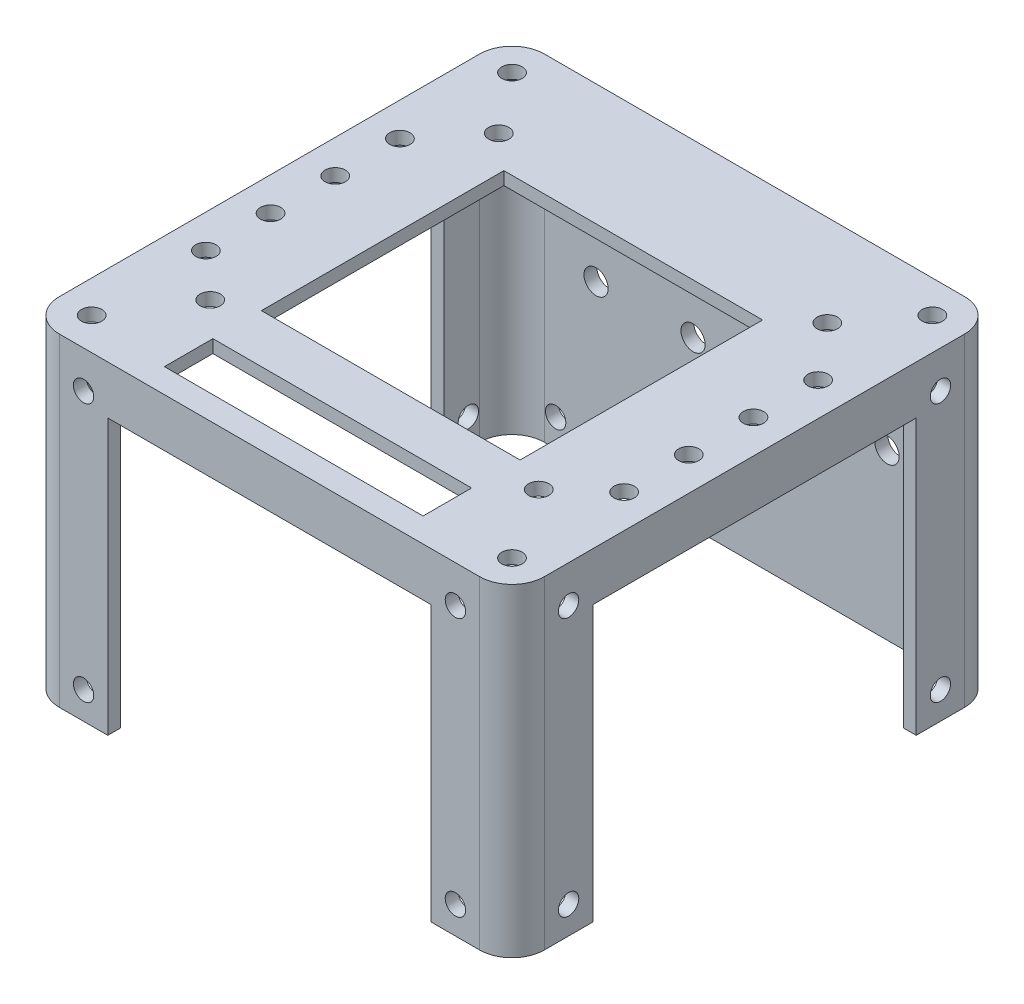
from build123d import *

# Parameters (mm, degrees)
SKETCH9_R                 = 3.15
BOSS_EXTRUDE10_DEPTH      = 10
BOSS_EXTRUDE10_2_DEPTH    = 10
BOSS_EXTRUDE10_3_DEPTH    = 10
BOSS_EXTRUDE10_4_DEPTH    = 10
BOSS_EXTRUDE10_5_DEPTH    = 10
BOSS_EXTRUDE10_6_DEPTH    = 10
BOSS_EXTRUDE10_7_DEPTH    = 10
BOSS_EXTRUDE10_8_DEPTH    = 10
SKETCH10_W                = 80
SKETCH10_H                = 75
BOSS_EXTRUDE12_DEPTH      = 10
SKETCH15_R                = 3.15
BOSS_EXTRUDE17_DEPTH      = 10
BOSS_EXTRUDE17_2_DEPTH    = 10
BOSS_EXTRUDE17_3_DEPTH    = 10
BOSS_EXTRUDE17_4_DEPTH    = 10
SKETCH22_W                = 150
SKETCH22_H                = 150
BOSS_EXTRUDE19_DEPTH      = 4
SKETCH29_W                = 150
SKETCH29_H                = 150
SKETCH29_W_2              = 142
SKETCH29_H_2              = 142
BOSS_EXTRUDE20_DEPTH      = 100
FILLET12_R                = 10
SKETCH31_W                = 8
SKETCH31_H                = 100
BOSS_EXTRUDE21_DEPTH      = 100
BOSS_EXTRUDE21_2_DEPTH    = 100
SKETCH31_W_2              = 100
SKETCH31_H_2              = 8
BOSS_EXTRUDE21_3_DEPTH    = 100
SKETCH32_R                = 3.15
BOSS_EXTRUDE22_DEPTH      = 75
BOSS_EXTRUDE22_2_DEPTH    = 75
BOSS_EXTRUDE22_3_DEPTH    = 75
BOSS_EXTRUDE22_4_DEPTH    = 75
SKETCH34_R                = 3.15
BOSS_EXTRUDE23_DEPTH      = 150
BOSS_EXTRUDE23_2_DEPTH    = 150
BOSS_EXTRUDE23_3_DEPTH    = 150
BOSS_EXTRUDE23_4_DEPTH    = 150
SKETCH35_R                = 3.15
BOSS_EXTRUDE25_DEPTH      = 10
BOSS_EXTRUDE25_2_DEPTH    = 10
BOSS_EXTRUDE25_3_DEPTH    = 10
BOSS_EXTRUDE25_4_DEPTH    = 10
FILLET13_R                = 10
BOSS_EXTRUDE27_DEPTH      = 11
BOSS_EXTRUDE27_DEPTH_BACK = 96
SKETCH38_W                = 80
SKETCH38_H                = 15
BOSS_EXTRUDE28_DEPTH      = 3
BOSS_EXTRUDE28_2_DEPTH    = 3
BOSS_EXTRUDE28_3_DEPTH    = 3
BOSS_EXTRUDE28_4_DEPTH    = 3
SKETCH40_W                = 25
SKETCH40_H                = 25
BOSS_EXTRUDE31_DEPTH      = 4.5
BOSS_EXTRUDE31_2_DEPTH    = 4.5
BOSS_EXTRUDE31_3_DEPTH    = 4.5
BOSS_EXTRUDE31_4_DEPTH    = 4.5
SKETCH41_R                = 3.75
BOSS_EXTRUDE32_DEPTH      = 150
BOSS_EXTRUDE32_2_DEPTH    = 150
BOSS_EXTRUDE32_3_DEPTH    = 150
BOSS_EXTRUDE32_4_DEPTH    = 150
FILLET14_R                = 15


with BuildPart() as part:
    # Sketch9 → Boss-Extrude10 (new, symmetric)
    with BuildSketch(Plane(origin=(0, 0, 0), x_dir=(1, 0, 0), z_dir=(0, 1, 0))):
        with Locations(Location((64.67, -30, 0), (0, 0, 270))):
            Circle(SKETCH9_R)
    extrude(amount=BOSS_EXTRUDE10_DEPTH, both=True)


with BuildPart() as body_2:
    # Sketch9 → Boss-Extrude10 2 (new, symmetric)
    with BuildSketch(Plane(origin=(0, 0, 0), x_dir=(1, 0, 0), z_dir=(0, 1, 0))):
        with Locations(Location((-64.67, -30, 0), (0, 0, 270))):
            Circle(SKETCH9_R)
    extrude(amount=BOSS_EXTRUDE10_2_DEPTH, both=True)


with BuildPart() as body_3:
    # Sketch9 → Boss-Extrude10 3 (new, symmetric)
    with BuildSketch(Plane(origin=(0, 0, 0), x_dir=(1, 0, 0), z_dir=(0, 1, 0))):
        with Locations(Location((64.67, -10, 0), (0, 0, 270))):
            Circle(SKETCH9_R)
    extrude(amount=BOSS_EXTRUDE10_3_DEPTH, both=True)


with BuildPart() as body_4:
    # Sketch9 → Boss-Extrude10 4 (new, symmetric)
    with BuildSketch(Plane(origin=(0, 0, 0), x_dir=(1, 0, 0), z_dir=(0, 1, 0))):
        with Locations(Location((-64.67, -10, 0), (0, 0, 270))):
            Circle(SKETCH9_R)
    extrude(amount=BOSS_EXTRUDE10_4_DEPTH, both=True)


with BuildPart() as body_5:
    # Sketch9 → Boss-Extrude10 5 (new, symmetric)
    with BuildSketch(Plane(origin=(0, 0, 0), x_dir=(1, 0, 0), z_dir=(0, 1, 0))):
        with Locations(Location((64.67, 10, 0), (0, 0, 270))):
            Circle(SKETCH9_R)
    extrude(amount=BOSS_EXTRUDE10_5_DEPTH, both=True)


with BuildPart() as body_6:
    # Sketch9 → Boss-Extrude10 6 (new, symmetric)
    with BuildSketch(Plane(origin=(0, 0, 0), x_dir=(1, 0, 0), z_dir=(0, 1, 0))):
        with Locations(Location((-64.67, 10, 0), (0, 0, 270))):
            Circle(SKETCH9_R)
    extrude(amount=BOSS_EXTRUDE10_6_DEPTH, both=True)


with BuildPart() as body_7:
    # Sketch9 → Boss-Extrude10 7 (new, symmetric)
    with BuildSketch(Plane(origin=(0, 0, 0), x_dir=(1, 0, 0), z_dir=(0, 1, 0))):
        with Locations(Location((64.67, 30, 0), (0, 0, 270))):
            Circle(SKETCH9_R)
    extrude(amount=BOSS_EXTRUDE10_7_DEPTH, both=True)


with BuildPart() as body_8:
    # Sketch9 → Boss-Extrude10 8 (new, symmetric)
    with BuildSketch(Plane(origin=(0, 0, 0), x_dir=(1, 0, 0), z_dir=(0, 1, 0))):
        with Locations(Location((-64.67, 30, 0), (0, 0, 270))):
            Circle(SKETCH9_R)
    extrude(amount=BOSS_EXTRUDE10_8_DEPTH, both=True)


with BuildPart() as body_9:
    # Sketch10 → Boss-Extrude12 (new, symmetric)
    with BuildSketch(Plane(origin=(0, 0, 0), x_dir=(1, 0, 0), z_dir=(0, 1, 0))):
        Rectangle(SKETCH10_W, SKETCH10_H)
    extrude(amount=BOSS_EXTRUDE12_DEPTH, both=True)


with BuildPart() as body_10:
    # Sketch15 → Boss-Extrude17 (new, symmetric)
    with BuildSketch(Plane(origin=(0, 0, 0), x_dir=(1, 0, 0), z_dir=(0, 1, 0))):
        with Locations(Location((-50.8, 46.711, 0), (0, 0, 270))):
            Circle(SKETCH15_R)
    extrude(amount=BOSS_EXTRUDE17_DEPTH, both=True)


with BuildPart() as body_11:
    # Sketch15 → Boss-Extrude17 2 (new, symmetric)
    with BuildSketch(Plane(origin=(0, 0, 0), x_dir=(1, 0, 0), z_dir=(0, 1, 0))):
        with Locations(Location((50.8, -42.532, 0), (0, 0, 270))):
            Circle(SKETCH15_R)
    extrude(amount=BOSS_EXTRUDE17_2_DEPTH, both=True)


with BuildPart() as body_12:
    # Sketch15 → Boss-Extrude17 3 (new, symmetric)
    with BuildSketch(Plane(origin=(0, 0, 0), x_dir=(1, 0, 0), z_dir=(0, 1, 0))):
        with Locations(Location((-50.8, -42.532, 0), (0, 0, 270))):
            Circle(SKETCH15_R)
    extrude(amount=BOSS_EXTRUDE17_3_DEPTH, both=True)


with BuildPart() as body_13:
    # Sketch15 → Boss-Extrude17 4 (new, symmetric)
    with BuildSketch(Plane(origin=(0, 0, 0), x_dir=(1, 0, 0), z_dir=(0, 1, 0))):
        with Locations(Location((50.8, 46.711, 0), (0, 0, 270))):
            Circle(SKETCH15_R)
    extrude(amount=BOSS_EXTRUDE17_4_DEPTH, both=True)


with BuildPart() as body_10_1:
    # Body-Move/Copy4: moved
    add(body_10.part.moved(Location((0, 1, 0))))


with BuildPart() as body_13_1:
    # Body-Move/Copy4: moved
    add(body_13.part.moved(Location((0, 1, 0))))


with BuildPart() as body_12_1:
    # Body-Move/Copy4: moved
    add(body_12.part.moved(Location((0, 1, 0))))


with BuildPart() as body_11_1:
    # Body-Move/Copy4: moved
    add(body_11.part.moved(Location((0, 1, 0))))


with BuildPart() as body_14:
    # Sketch22 → Boss-Extrude19 (new body)
    with BuildSketch(Plane(origin=(0, 0, 0), x_dir=(1, 0, 0), z_dir=(0, 1, 0))):
        Rectangle(SKETCH22_W, SKETCH22_H)
    extrude(amount=BOSS_EXTRUDE19_DEPTH)

    # Sketch29 → Boss-Extrude20 (add)
    with BuildSketch(Plane(origin=(0, 4, 0), x_dir=(1, 0, 0), z_dir=(0, 1, 0))):
        Rectangle(SKETCH29_W, SKETCH29_H)
        Rectangle(SKETCH29_W_2, SKETCH29_H_2, mode=Mode.SUBTRACT)
    extrude(amount=-BOSS_EXTRUDE20_DEPTH)

    # Fillet12
    fillet12_edges = [body_14.edges().sort_by_distance(p)[0] for p in [
        (75, -46, 75),
        (-75, -46, 75),
        (-75, -46, -75),
        (75, -46, -75),
    ]]
    fillet(fillet12_edges, radius=FILLET12_R)


with BuildPart() as body_15:
    # Sketch31 → Boss-Extrude21 (new body)
    with BuildSketch(Plane(origin=(0, 4, 0), x_dir=(1, 0, 0), z_dir=(0, 1, 0))):
        with Locations((-75, 0)):
            Rectangle(SKETCH31_W, SKETCH31_H)
    extrude(amount=-BOSS_EXTRUDE21_DEPTH)


with BuildPart() as body_16:
    # Sketch31 → Boss-Extrude21 2 (new body)
    with BuildSketch(Plane(origin=(0, 4, 0), x_dir=(1, 0, 0), z_dir=(0, 1, 0))):
        with Locations((75, 0)):
            Rectangle(SKETCH31_W, SKETCH31_H)
    extrude(amount=-BOSS_EXTRUDE21_2_DEPTH)


with BuildPart() as body_17:
    # Sketch31 → Boss-Extrude21 3 (new body)
    with BuildSketch(Plane(origin=(0, 4, 0), x_dir=(1, 0, 0), z_dir=(0, 1, 0))):
        with Locations((0, -75)):
            Rectangle(SKETCH31_W_2, SKETCH31_H_2)
    extrude(amount=-BOSS_EXTRUDE21_3_DEPTH)


with BuildPart() as body_17_1:
    # Body-Move/Copy5: moved
    add(body_17.part.moved(Location((0, -15, 0))))


with BuildPart() as body_16_1:
    # Body-Move/Copy5: moved
    add(body_16.part.moved(Location((0, -15, 0))))


with BuildPart() as body_15_1:
    # Body-Move/Copy5: moved
    add(body_15.part.moved(Location((0, -15, 0))))


with BuildPart() as body_18:
    # Sketch32 → Boss-Extrude22 (new, symmetric)
    with BuildSketch(Plane.XY):
        with Locations((57.5, -7.5)):
            Circle(SKETCH32_R)
    extrude(amount=BOSS_EXTRUDE22_DEPTH, both=True)


with BuildPart() as body_19:
    # Sketch32 → Boss-Extrude22 2 (new, symmetric)
    with BuildSketch(Plane.XY):
        with Locations((-57.5, -7.5)):
            Circle(SKETCH32_R)
    extrude(amount=BOSS_EXTRUDE22_2_DEPTH, both=True)


with BuildPart() as body_20:
    # Sketch32 → Boss-Extrude22 3 (new, symmetric)
    with BuildSketch(Plane.XY):
        with Locations((-57.5, -87.5)):
            Circle(SKETCH32_R)
    extrude(amount=BOSS_EXTRUDE22_3_DEPTH, both=True)


with BuildPart() as body_21:
    # Sketch32 → Boss-Extrude22 4 (new, symmetric)
    with BuildSketch(Plane.XY):
        with Locations((57.5, -87.5)):
            Circle(SKETCH32_R)
    extrude(amount=BOSS_EXTRUDE22_4_DEPTH, both=True)


with BuildPart() as body_22:
    # Sketch34 → Boss-Extrude23 (new body)
    with BuildSketch(Plane(origin=(75, 0, 0), x_dir=(0, 0, -1), z_dir=(1, 0, 0))):
        with Locations((-57.5, -7.5)):
            Circle(SKETCH34_R)
    extrude(amount=-BOSS_EXTRUDE23_DEPTH)


with BuildPart() as body_23:
    # Sketch34 → Boss-Extrude23 2 (new body)
    with BuildSketch(Plane(origin=(75, 0, 0), x_dir=(0, 0, -1), z_dir=(1, 0, 0))):
        with Locations((57.5, -7.5)):
            Circle(SKETCH34_R)
    extrude(amount=-BOSS_EXTRUDE23_2_DEPTH)


with BuildPart() as body_24:
    # Sketch34 → Boss-Extrude23 3 (new body)
    with BuildSketch(Plane(origin=(75, 0, 0), x_dir=(0, 0, -1), z_dir=(1, 0, 0))):
        with Locations((-57.5, -87.5)):
            Circle(SKETCH34_R)
    extrude(amount=-BOSS_EXTRUDE23_3_DEPTH)


with BuildPart() as body_25:
    # Sketch34 → Boss-Extrude23 4 (new body)
    with BuildSketch(Plane(origin=(75, 0, 0), x_dir=(0, 0, -1), z_dir=(1, 0, 0))):
        with Locations((57.5, -87.5)):
            Circle(SKETCH34_R)
    extrude(amount=-BOSS_EXTRUDE23_4_DEPTH)


with BuildPart() as body_14_1:
    add(body_14.part)

    # Combine4: cut body 24, body 23, body 22, body 21, body 20, body 19, body 18, body 15, body 16, body 17, body 25
    add(body_24.part, mode=Mode.SUBTRACT)
    add(body_23.part, mode=Mode.SUBTRACT)
    add(body_22.part, mode=Mode.SUBTRACT)
    add(body_21.part, mode=Mode.SUBTRACT)
    add(body_20.part, mode=Mode.SUBTRACT)
    add(body_19.part, mode=Mode.SUBTRACT)
    add(body_18.part, mode=Mode.SUBTRACT)
    add(body_15_1.part, mode=Mode.SUBTRACT)
    add(body_16_1.part, mode=Mode.SUBTRACT)
    add(body_17_1.part, mode=Mode.SUBTRACT)
    add(body_25.part, mode=Mode.SUBTRACT)

    # Fillet13
    fillet13_edges = [body_14_1.edges().sort_by_distance(p)[0] for p in [
        (71, -48, 71),
        (-71, -48, 71),
        (-71, -48, -71),
        (71, -48, -71),
    ]]
    fillet(fillet13_edges, radius=FILLET13_R)


with BuildPart() as body_15_2:
    # Sketch35 → Boss-Extrude25 (new, symmetric)
    with BuildSketch(Plane(origin=(0, 0, 0), x_dir=(1, 0, 0), z_dir=(0, 1, 0))):
        with Locations(Location((65, -65, 0), (0, 0, 270))):
            Circle(SKETCH35_R)
    extrude(amount=BOSS_EXTRUDE25_DEPTH, both=True)


with BuildPart() as body_16_2:
    # Sketch35 → Boss-Extrude25 2 (new, symmetric)
    with BuildSketch(Plane(origin=(0, 0, 0), x_dir=(1, 0, 0), z_dir=(0, 1, 0))):
        with Locations(Location((-65, 65, 0), (0, 0, 270))):
            Circle(SKETCH35_R)
    extrude(amount=BOSS_EXTRUDE25_2_DEPTH, both=True)


with BuildPart() as body_17_2:
    # Sketch35 → Boss-Extrude25 3 (new, symmetric)
    with BuildSketch(Plane(origin=(0, 0, 0), x_dir=(1, 0, 0), z_dir=(0, 1, 0))):
        with Locations(Location((-65, -65, 0), (0, 0, 270))):
            Circle(SKETCH35_R)
    extrude(amount=BOSS_EXTRUDE25_3_DEPTH, both=True)


with BuildPart() as body_18_2:
    # Sketch35 → Boss-Extrude25 4 (new, symmetric)
    with BuildSketch(Plane(origin=(0, 0, 0), x_dir=(1, 0, 0), z_dir=(0, 1, 0))):
        with Locations(Location((65, 65, 0), (0, 0, 270))):
            Circle(SKETCH35_R)
    extrude(amount=BOSS_EXTRUDE25_4_DEPTH, both=True)


with BuildPart() as body_19_2:
    # Sketch38 → Boss-Extrude27 (new, two sides: drawn at the far end of the back side and taken through both)
    with BuildSketch(Plane(origin=(0, 0, 0), x_dir=(1, 0, 0), z_dir=(0, 1, 0)).offset(-BOSS_EXTRUDE27_DEPTH_BACK)):
        with Locations((0, -60)):
            Rectangle(SKETCH38_W, SKETCH38_H)
    extrude(amount=BOSS_EXTRUDE27_DEPTH + BOSS_EXTRUDE27_DEPTH_BACK)


with BuildPart() as body_14_2:
    add(body_14_1.part)

    # Combine12: cut body 19 2, body 17 2, body 16 2, body 15 2, body 18 2
    add(body_19_2.part, mode=Mode.SUBTRACT)
    add(body_17_2.part, mode=Mode.SUBTRACT)
    add(body_16_2.part, mode=Mode.SUBTRACT)
    add(body_15_2.part, mode=Mode.SUBTRACT)
    add(body_18_2.part, mode=Mode.SUBTRACT)

    # Combine13: cut body 11, body 12, body 13, body 10, body 9, body 2, part
    add(body_11_1.part, mode=Mode.SUBTRACT)
    add(body_12_1.part, mode=Mode.SUBTRACT)
    add(body_13_1.part, mode=Mode.SUBTRACT)
    add(body_10_1.part, mode=Mode.SUBTRACT)
    add(body_9.part, mode=Mode.SUBTRACT)
    add(body_2.part, mode=Mode.SUBTRACT)
    add(part.part, mode=Mode.SUBTRACT)


with BuildPart() as body_8_2:
    # Sketch36 → Boss-Extrude28 (new body)
    with BuildSketch(Plane(origin=(0, 0, 0), x_dir=(1, 0, 0), z_dir=(0, 1, 0))):
        with BuildLine():
            Line((-40.150757595, -52.878679656), (-57.121320344, -69.849242405))
            ThreePointArc((-57.121320344, -69.849242405), (-69.849242405, -69.849242405), (-69.849242405, -57.121320344))
            Line((-69.849242405, -57.121320344), (-52.878679656, -40.150757595))
            ThreePointArc((-52.878679656, -40.150757595), (-40.150757595, -40.150757595), (-40.150757595, -52.878679656))
        make_face()
    extrude(amount=-BOSS_EXTRUDE28_DEPTH)


with BuildPart() as body_9_2:
    # Sketch36 → Boss-Extrude28 2 (new body)
    with BuildSketch(Plane(origin=(0, 0, 0), x_dir=(1, 0, 0), z_dir=(0, 1, 0))):
        with BuildLine():
            Line((-52.878679656, 40.150757595), (-69.849242405, 57.121320344))
            ThreePointArc((-69.849242405, 57.121320344), (-69.849242405, 69.849242405), (-57.121320344, 69.849242405))
            Line((-57.121320344, 69.849242405), (-40.150757595, 52.878679656))
            ThreePointArc((-40.150757595, 52.878679656), (-40.150757595, 40.150757595), (-52.878679656, 40.150757595))
        make_face()
    extrude(amount=-BOSS_EXTRUDE28_2_DEPTH)


with BuildPart() as body_10_2:
    # Sketch36 → Boss-Extrude28 3 (new body)
    with BuildSketch(Plane(origin=(0, 0, 0), x_dir=(1, 0, 0), z_dir=(0, 1, 0))):
        with BuildLine():
            Line((52.878679656, -40.150757595), (69.849242405, -57.121320344))
            ThreePointArc((69.849242405, -57.121320344), (69.849242405, -69.849242405), (57.121320344, -69.849242405))
            Line((57.121320344, -69.849242405), (40.150757595, -52.878679656))
            ThreePointArc((40.150757595, -52.878679656), (40.150757595, -40.150757595), (52.878679656, -40.150757595))
        make_face()
    extrude(amount=-BOSS_EXTRUDE28_3_DEPTH)


with BuildPart() as body_11_2:
    # Sketch36 → Boss-Extrude28 4 (new body)
    with BuildSketch(Plane(origin=(0, 0, 0), x_dir=(1, 0, 0), z_dir=(0, 1, 0))):
        with BuildLine():
            Line((40.150757595, 52.878679656), (57.121320344, 69.849242405))
            ThreePointArc((57.121320344, 69.849242405), (69.849242405, 69.849242405), (69.849242405, 57.121320344))
            Line((69.849242405, 57.121320344), (52.878679656, 40.150757595))
            ThreePointArc((52.878679656, 40.150757595), (40.150757595, 40.150757595), (40.150757595, 52.878679656))
        make_face()
    extrude(amount=-BOSS_EXTRUDE28_4_DEPTH)


with BuildPart() as body_12_2:
    # Sketch40 → Boss-Extrude31 (new body)
    with BuildSketch(Plane(origin=(0, 0, 0), x_dir=(1, 0, 0), z_dir=(0, 1, 0))):
        with Locations((58.5, -58.5)):
            Rectangle(SKETCH40_W, SKETCH40_H)
    extrude(amount=-BOSS_EXTRUDE31_DEPTH)


with BuildPart() as body_13_2:
    # Sketch40 → Boss-Extrude31 2 (new body)
    with BuildSketch(Plane(origin=(0, 0, 0), x_dir=(1, 0, 0), z_dir=(0, 1, 0))):
        with Locations((58.5, 58.5)):
            Rectangle(SKETCH40_W, SKETCH40_H)
    extrude(amount=-BOSS_EXTRUDE31_2_DEPTH)


with BuildPart() as body_14_2_1:
    # Sketch40 → Boss-Extrude31 3 (new body)
    with BuildSketch(Plane(origin=(0, 0, 0), x_dir=(1, 0, 0), z_dir=(0, 1, 0))):
        with Locations((-58.5, 58.5)):
            Rectangle(SKETCH40_W, SKETCH40_H)
    extrude(amount=-BOSS_EXTRUDE31_3_DEPTH)


with BuildPart() as body_15_3:
    # Sketch40 → Boss-Extrude31 4 (new body)
    with BuildSketch(Plane(origin=(0, 0, 0), x_dir=(1, 0, 0), z_dir=(0, 1, 0))):
        with Locations((-58.5, -58.5)):
            Rectangle(SKETCH40_W, SKETCH40_H)
    extrude(amount=-BOSS_EXTRUDE31_4_DEPTH)


with BuildPart() as body_12_2_1:
    add(body_12_2.part)

    # Combine15: union body 13 2, body 14 2, body 15 3, body 14
    add(body_13_2.part)
    add(body_14_2_1.part)
    add(body_15_3.part)
    add(body_14_2.part)

    # Combine16: cut body 11 2, body 10 2, body 9 2, body 8 2
    add(body_11_2.part, mode=Mode.SUBTRACT)
    add(body_10_2.part, mode=Mode.SUBTRACT)
    add(body_9_2.part, mode=Mode.SUBTRACT)
    add(body_8_2.part, mode=Mode.SUBTRACT)

    # Combine17: cut body 8, body 7, body 6, body 5, body 4, body 3
    add(body_8.part, mode=Mode.SUBTRACT)
    add(body_7.part, mode=Mode.SUBTRACT)
    add(body_6.part, mode=Mode.SUBTRACT)
    add(body_5.part, mode=Mode.SUBTRACT)
    add(body_4.part, mode=Mode.SUBTRACT)
    add(body_3.part, mode=Mode.SUBTRACT)


with BuildPart() as body_2_2:
    # Sketch41 → Boss-Extrude32 (new, through all)
    with BuildSketch(Plane(origin=(0, 0, -75), x_dir=(-1, 0, 0), z_dir=(0, 0, -1))):
        with Locations((-45, -45)):
            Circle(SKETCH41_R)
    extrude(amount=-BOSS_EXTRUDE32_DEPTH)


with BuildPart() as body_3_2:
    # Sketch41 → Boss-Extrude32 2 (new, through all)
    with BuildSketch(Plane(origin=(0, 0, -75), x_dir=(-1, 0, 0), z_dir=(0, 0, -1))):
        with Locations((-15, -45)):
            Circle(SKETCH41_R)
    extrude(amount=-BOSS_EXTRUDE32_2_DEPTH)


with BuildPart() as body_4_2:
    # Sketch41 → Boss-Extrude32 3 (new, through all)
    with BuildSketch(Plane(origin=(0, 0, -75), x_dir=(-1, 0, 0), z_dir=(0, 0, -1))):
        with Locations((15, -45)):
            Circle(SKETCH41_R)
    extrude(amount=-BOSS_EXTRUDE32_3_DEPTH)


with BuildPart() as body_5_2:
    # Sketch41 → Boss-Extrude32 4 (new, through all)
    with BuildSketch(Plane(origin=(0, 0, -75), x_dir=(-1, 0, 0), z_dir=(0, 0, -1))):
        with Locations((45, -45)):
            Circle(SKETCH41_R)
    extrude(amount=-BOSS_EXTRUDE32_4_DEPTH)


with BuildPart() as body_12_2_2:
    add(body_12_2_1.part)

    # Combine18: cut body 4 2, body 3 2, body 2 2, body 5 2
    add(body_4_2.part, mode=Mode.SUBTRACT)
    add(body_3_2.part, mode=Mode.SUBTRACT)
    add(body_2_2.part, mode=Mode.SUBTRACT)
    add(body_5_2.part, mode=Mode.SUBTRACT)

    # Fillet14
    # the kernel refuses this fillet: 15 mm, written as the material it takes off along each edge
    with BuildSketch(Plane(origin=(-46, 34.5, 46), x_dir=(-1, 0, 0), z_dir=(0, -1, 0))) as fillet14_piece_1_section:
        with BuildLine():
            CenterArc((FILLET14_R, -FILLET14_R), FILLET14_R, 90, 90)
            Line((0, -FILLET14_R), (0, 0))
            Line((0, 0), (FILLET14_R, 0))
        make_face()
    fillet14_piece_1 = extrude(amount=76.5, mode=Mode.PRIVATE)
    fillet14_piece_1 = split(fillet14_piece_1, bisect_by=Plane(origin=(-59.35249566, 0, 46.045676814), z_dir=(0, -1, 0)), keep=Keep.TOP, mode=Mode.PRIVATE)
    add(fillet14_piece_1, mode=Mode.SUBTRACT)
    with BuildSketch(Plane(origin=(-46, 34.5, -46), x_dir=(-1, 0, 0), z_dir=(0, -1, 0))) as fillet14_piece_2_section:
        with BuildLine():
            CenterArc((FILLET14_R, FILLET14_R), FILLET14_R, 180, 90)
            Line((0, FILLET14_R), (0, 0))
            Line((0, 0), (FILLET14_R, 0))
        make_face()
    fillet14_piece_2 = extrude(amount=76.5, mode=Mode.PRIVATE)
    fillet14_piece_2 = split(fillet14_piece_2, bisect_by=Plane(origin=(-59.35249566, 0, -46.045676814), z_dir=(0, -1, 0)), keep=Keep.TOP, mode=Mode.PRIVATE)
    add(fillet14_piece_2, mode=Mode.SUBTRACT)
    with BuildSketch(Plane(origin=(46, 34.5, -46), x_dir=(0, 0, -1), z_dir=(0, -1, 0))) as fillet14_piece_3_section:
        with BuildLine():
            CenterArc((FILLET14_R, FILLET14_R), FILLET14_R, 180, 90)
            Line((0, FILLET14_R), (0, 0))
            Line((0, 0), (FILLET14_R, 0))
        make_face()
    fillet14_piece_3 = extrude(amount=76.5, mode=Mode.PRIVATE)
    fillet14_piece_3 = split(fillet14_piece_3, bisect_by=Plane(origin=(46.045676814, 0, -59.35249566), z_dir=(0, -1, 0)), keep=Keep.TOP, mode=Mode.PRIVATE)
    add(fillet14_piece_3, mode=Mode.SUBTRACT)
    with BuildSketch(Plane(origin=(46, 34.5, 46), x_dir=(1, 0, 0), z_dir=(0, -1, 0))) as fillet14_piece_4_section:
        with BuildLine():
            CenterArc((FILLET14_R, FILLET14_R), FILLET14_R, 180, 90)
            Line((0, FILLET14_R), (0, 0))
            Line((0, 0), (FILLET14_R, 0))
        make_face()
    fillet14_piece_4 = extrude(amount=76.5, mode=Mode.PRIVATE)
    fillet14_piece_4 = split(fillet14_piece_4, bisect_by=Plane(origin=(59.35249566, 0, 46.045676814), z_dir=(0, -1, 0)), keep=Keep.TOP, mode=Mode.PRIVATE)
    add(fillet14_piece_4, mode=Mode.SUBTRACT)


solid = body_12_2_2.part
